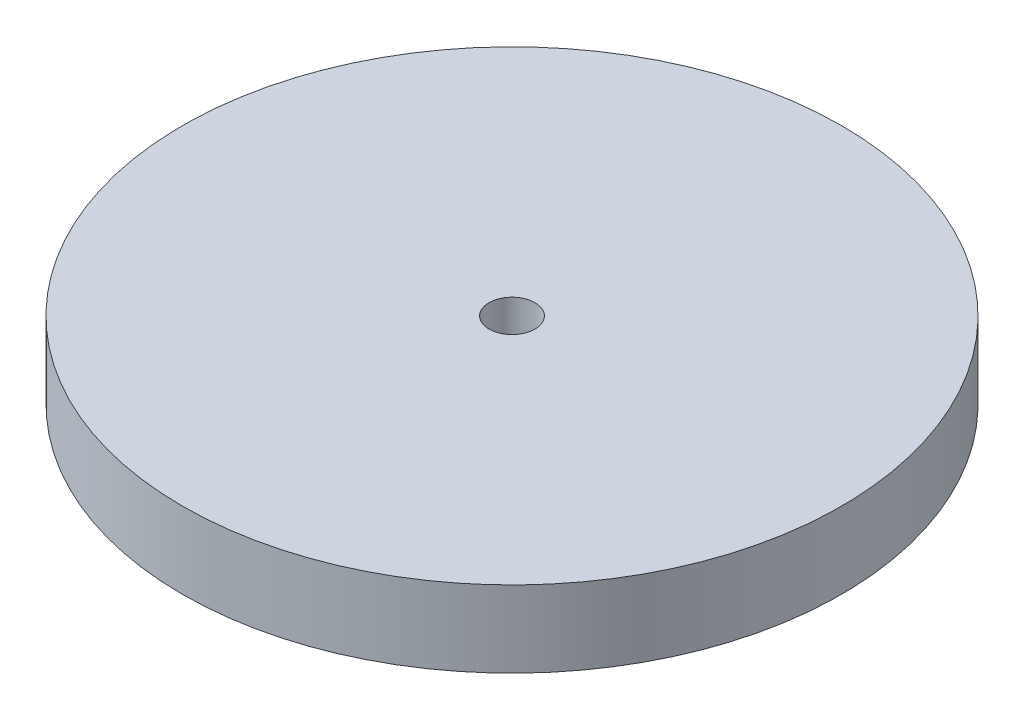
from build123d import *

# Parameters (mm, degrees)
SKETCH1_R           = 34.5
SKETCH1_R_2         = 2.4
BOSS_EXTRUDE1_DEPTH = 8


with BuildPart() as part:
    # Sketch1 → Boss-Extrude1 (new body)
    with BuildSketch(Plane(origin=(0, 0, 0), x_dir=(1, 0, 0), z_dir=(0, 1, 0))):
        Circle(SKETCH1_R)
        Circle(SKETCH1_R_2, mode=Mode.SUBTRACT)
    extrude(amount=BOSS_EXTRUDE1_DEPTH)


solid = part.part
